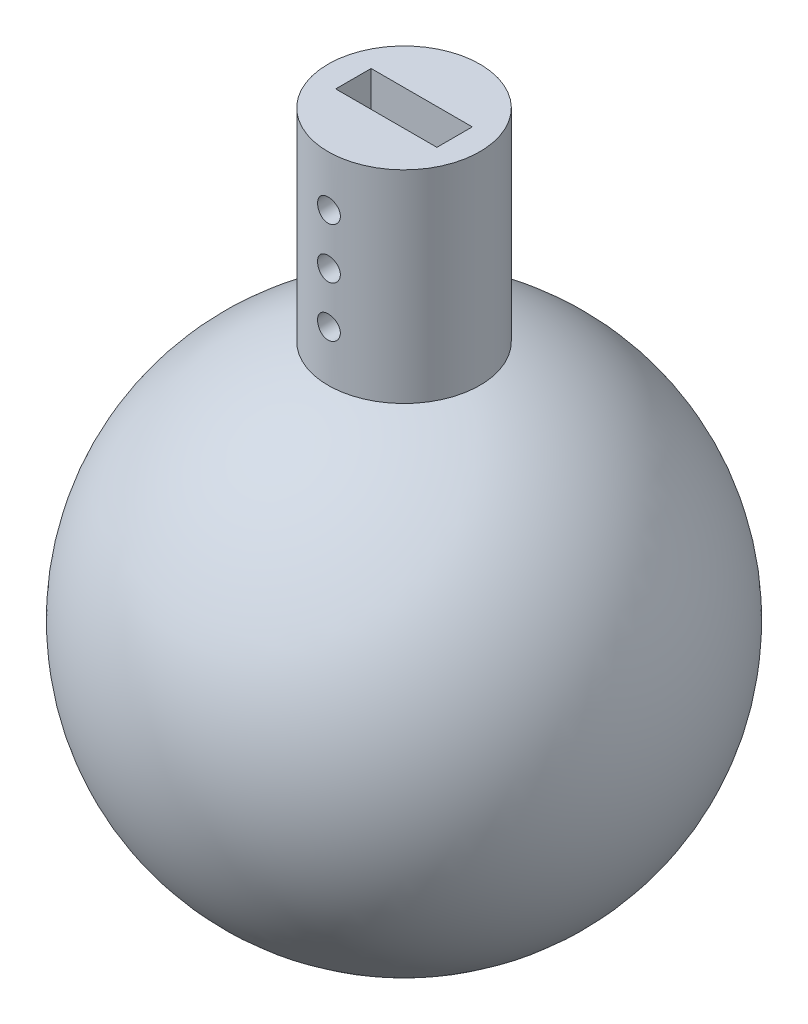
from build123d import *

# Parameters (mm, degrees)
CUT_EXTRUDE1_DEPTH      = 15
CUT_EXTRUDE1_DEPTH_BACK = 15
SKETCH2_R               = 2.25
SKETCH3_W               = 20
SKETCH3_H               = 7
CUT_EXTRUDE2_DEPTH      = 40


with BuildPart() as part:
    # Sketch1 → Revolve1 (revolve)
    with BuildSketch(Plane.XY):
        with BuildLine():
            Line((0, 0), (0, 40))
            Line((0, 40), (15, 40))
            Line((15, 40), (15, -47.696960071))
            Line((15, -47.696960071), (15, -97.696960071))
            ThreePointArc((15, -97.696960071), (-34.420886291, -55.284845035), (0, 0))
        make_face()
    revolve(axis=Axis((15, 40, 0), (0, -1, 0)))

    # Sketch2 → Cut-Extrude1 (cut, two sides: drawn at the far end of the back side and taken through both)
    with BuildSketch(Plane.XY.offset(-CUT_EXTRUDE1_DEPTH_BACK)):
        with Locations((15, 30)):
            Circle(SKETCH2_R)
        with Locations((15, 20)):
            Circle(SKETCH2_R)
        with Locations((15, 10)):
            Circle(SKETCH2_R)
    extrude(amount=CUT_EXTRUDE1_DEPTH + CUT_EXTRUDE1_DEPTH_BACK, mode=Mode.SUBTRACT)

    # Sketch3 → Cut-Extrude2 (cut)
    with BuildSketch(Plane(origin=(0, 40, 0), x_dir=(1, 0, 0), z_dir=(0, 1, 0))):
        with Locations((15, 0)):
            Rectangle(SKETCH3_W, SKETCH3_H)
    extrude(amount=-CUT_EXTRUDE2_DEPTH, mode=Mode.SUBTRACT)


solid = part.part
